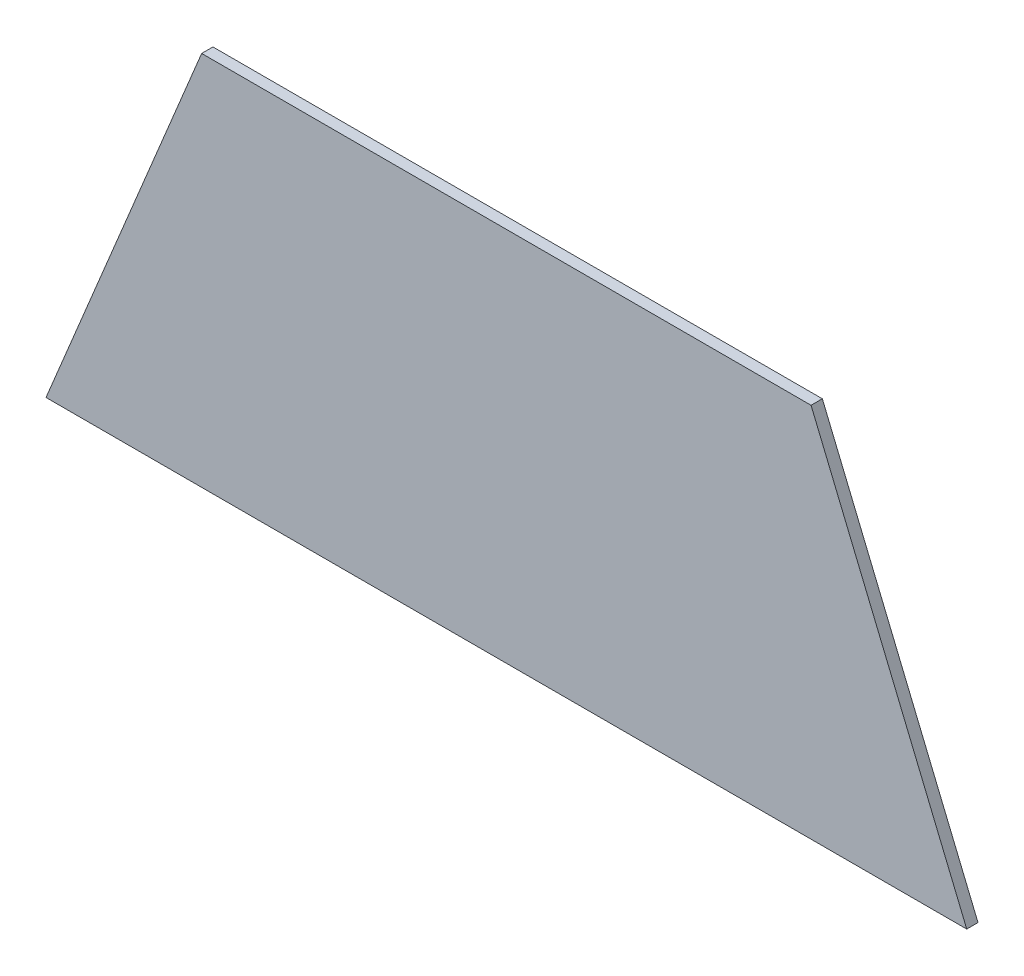
from build123d import *

# Parameters (mm, degrees)
BOSS_EXTRUDE1_DEPTH = 3


with BuildPart() as part:
    # Sketch1 → Boss-Extrude1 (new body)
    with BuildSketch(Plane.XY):
        Polygon((0, 0), (245, 0), (203.578643763, 100), (41.421356237, 100), align=None)
    extrude(amount=BOSS_EXTRUDE1_DEPTH)


solid = part.part
